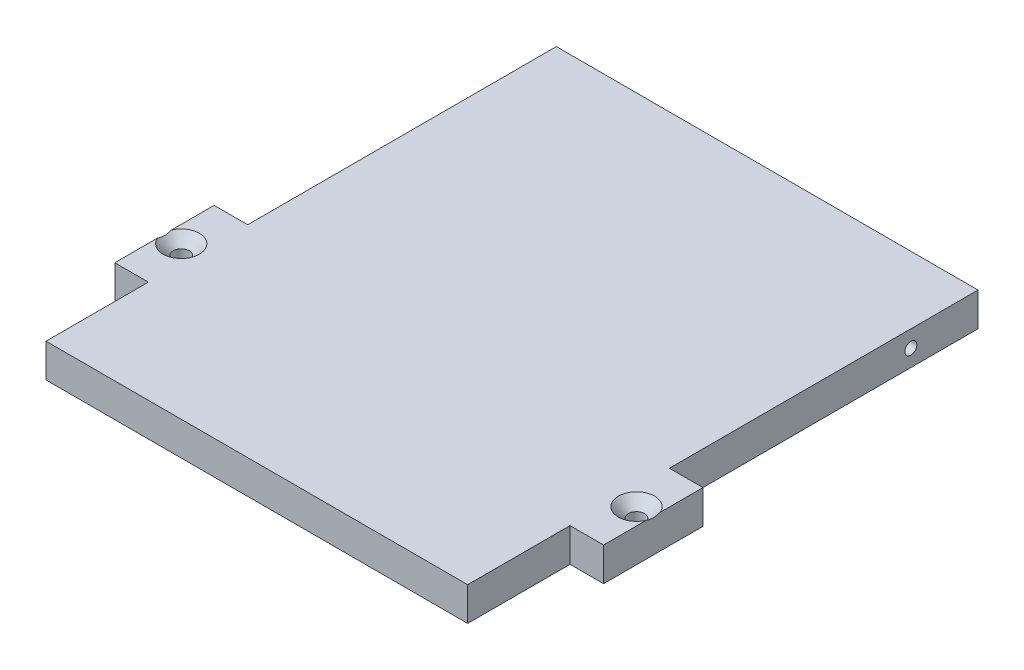
from build123d import *

# Parameters (mm, degrees)
SKETCH1_R           = 1.524
BOSS_EXTRUDE1_DEPTH = 6.35
CHAMFER1_SIZE       = 1.905
SKETCH2_R           = 1.1303
CUT_EXTRUDE1_DEPTH  = 12.7


with BuildPart() as part:
    # Sketch1 → Boss-Extrude1 (new body)
    with BuildSketch(Plane(origin=(0, 0, 0), x_dir=(1, 0, 0), z_dir=(0, 1, 0))):
        Polygon((39.688377001, 76.199995009), (39.688377001, 96.236406132), (-40.067622999, 96.236406132), (-40.067622999, 76.199995009), (-40.067622999, 57.403995009), (-40.067622999, 37.867206132), (-46.417622999, 37.867206132), (-46.417622999, 19.071206132), (-40.067622999, 19.071206132), (-40.067622999, -0.283593868), (39.688377001, -0.283593868), (39.688377001, 19.071206132), (46.038377001, 19.071206132), (46.038377001, 37.867206132), (39.688377001, 37.867206132), (39.688377001, 57.403995009), align=None)
        with Locations(Location((-43.242622999, 28.469206132, 0), (0, 0, 270))):
            Circle(SKETCH1_R, mode=Mode.SUBTRACT)
        with Locations(Location((42.863377001, 28.469206132, 0), (0, 0, 270))):
            Circle(SKETCH1_R, mode=Mode.SUBTRACT)
    extrude(amount=BOSS_EXTRUDE1_DEPTH)

    # Chamfer1
    # the kernel refuses this chamfer: 1.905 mm, written as the material it takes off along each edge
    with BuildSketch(Plane(origin=(42.863377001, 6.35, -28.469206132), x_dir=(0, 0, 1), z_dir=(-1, 0, 0))) as chamfer1_piece_1:
        Polygon((1.524 + CHAMFER1_SIZE, 0), (1.524, -CHAMFER1_SIZE), (1.524, 0), align=None)
    revolve(axis=Axis((42.863377001, 6.35, -28.469206132), (0, 1, 0)), mode=Mode.SUBTRACT)
    with BuildSketch(Plane(origin=(-43.242622999, 6.35, -28.469206132), x_dir=(0, 0, 1), z_dir=(-1, 0, 0))) as chamfer1_piece_2:
        Polygon((1.524 + CHAMFER1_SIZE, 0), (1.524, -CHAMFER1_SIZE), (1.524, 0), align=None)
    revolve(axis=Axis((-43.242622999, 6.35, -28.469206132), (0, 1, 0)), mode=Mode.SUBTRACT)

    # Sketch2 → Cut-Extrude1 (cut)
    with BuildSketch(Plane.ZY.offset(40.067622999)):
        with Locations((-83.536406132, 3.175)):
            Circle(SKETCH2_R)
    cut_extrude1 = extrude(amount=-CUT_EXTRUDE1_DEPTH, mode=Mode.SUBTRACT)

    # Mirror5: Cut-Extrude1 across plane
    add(cut_extrude1.mirror(Plane(origin=(0, 0, 0), x_dir=(0, 0, 1), z_dir=(1, 0, 0))), mode=Mode.SUBTRACT)


solid = part.part
